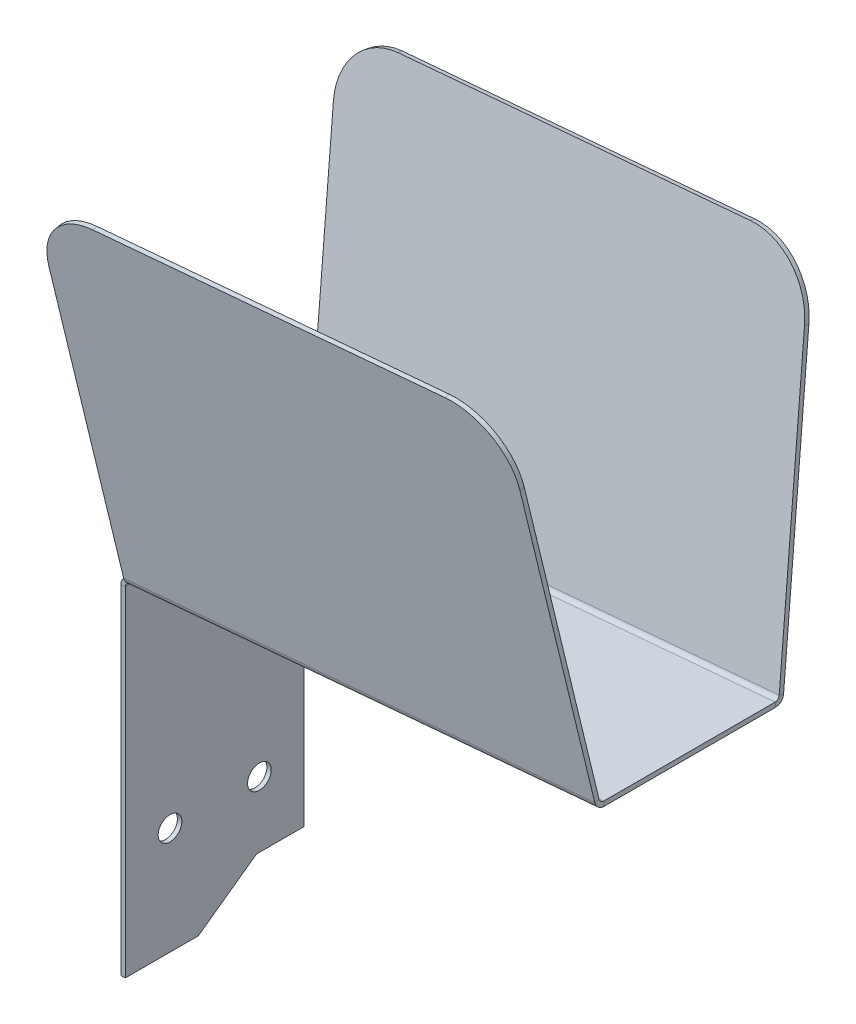
from build123d import *

# Parameters (mm, degrees)
SKETCH1_W                    = 30
SKETCH1_H                    = 57.5
BASE_FLANGE1_DEPTH           = 0.7366
EDGE_FLANGE1_STRIP_CUT_DEPTH = 30
EDGE_FLANGE1_DEPTH           = 30
EDGE_FLANGE2_STRIP_CUT_DEPTH = 79.325030457
EDGE_FLANGE2_DEPTH           = 79.325030457
FILLET1_R                    = 10
CUT_EXTRUDE1_DEPTH           = 126.57552091
CUT_EXTRUDE1_DEPTH_BACK      = 126.57552091
SKETCH14_R                   = 1.984375
CUT_EXTRUDE2_DEPTH           = 126.57552091


# Sheet-metal steps are written as plain solids
with BuildPart() as part:
    # Sketch1 → Base-Flange1 (new body)
    with BuildSketch(Plane(origin=(0, 0, 0), x_dir=(0, 0, -1), z_dir=(1, 0, 0))):
        Rectangle(SKETCH1_W, SKETCH1_H)
    extrude(amount=-BASE_FLANGE1_DEPTH)

    # Edge-Flange1 strip (across the edge) → Edge-Flange1 strip cut (cut)
    with BuildSketch(Plane(origin=(0, 28.75, -15), x_dir=(0.087155742747662, -0.9961946980917452, 0), z_dir=(0, 0, 1))):
        Polygon((-3.794579928, -0.407430966), (0.60820216, -0.792624486), (0.67240108, -0.058827472), (-3.730381008, 0.326366049), align=None)
    extrude(amount=EDGE_FLANGE1_STRIP_CUT_DEPTH, mode=Mode.SUBTRACT)

    # Edge-Flange1 section (across the edge) → Edge-Flange1 (add)
    with BuildSketch(Plane(origin=(0, 28.75, -15), x_dir=(0.087155742747662, -0.9961946980917452, 0), z_dir=(0, 0, 1))):
        with BuildLine():
            Line((-0.7366, 0.674969543), (-0.7366, 80))
            Line((-0.7366, 80), (0, 80))
            Line((0, 80), (0, 0.674969543))
            ThreePointArc((0, 0.674969543), (0.193521514, 0.177329796), (0.67240108, -0.058827472))
            Line((0.67240108, -0.058827472), (0.60820216, -0.792624486))
            ThreePointArc((0.60820216, -0.792624486), (-0.349556973, -0.320309951), (-0.7366, 0.674969543))
        make_face()
    extrude(amount=EDGE_FLANGE1_DEPTH)

    # Edge-Flange2 strip (across the edge) → Edge-Flange2 strip cut (cut)
    with BuildSketch(Plane(origin=(0.60820216, 29.542624486, 15), x_dir=(-0.015134435901339633, 0.17298739392509335, -0.9848077530122075), z_dir=(0.9961946980917453, 0.08715574274766204, 0))):
        Polygon((-3.871674841, -0.065282507), (0.480781505, -0.832737993), (0.608690752, -0.107328603), (-3.743765593, 0.660126883), align=None)
    edge_flange2_strip_cut = extrude(amount=EDGE_FLANGE2_STRIP_CUT_DEPTH, mode=Mode.SUBTRACT)

    # Edge-Flange2 section (across the edge) → Edge-Flange2 (add)
    with BuildSketch(Plane(origin=(0.60820216, 29.542624486, 15), x_dir=(-0.015134435901339633, 0.17298739392509335, -0.9848077530122075), z_dir=(0.9961946980917453, 0.08715574274766204, 0))):
        with BuildLine():
            Line((-0.7366, 0.618080788), (-0.7366, 59))
            Line((-0.7366, 59), (0, 59))
            Line((0, 59), (0, 0.618080788))
            ThreePointArc((0, 0.618080788), (0.172331663, 0.144603435), (0.608690752, -0.107328603))
            Line((0.608690752, -0.107328603), (0.480781505, -0.832737993))
            ThreePointArc((0.480781505, -0.832737993), (-0.391936674, -0.328873918), (-0.7366, 0.618080788))
        make_face()
    edge_flange2 = extrude(amount=EDGE_FLANGE2_DEPTH)

    # Mirror1: Edge-Flange2 strip cut, Edge-Flange2 across plane
    add(edge_flange2_strip_cut.mirror(Plane.XY), mode=Mode.SUBTRACT)
    add(edge_flange2.mirror(Plane.XY))

    # Fillet1
    fillet1_edges = [part.edges().sort_by_distance(p)[0] for p in [
        (74.572883521, 94.275100646, -25.607947178),
        (-4.450291247, 87.361468698, -25.607947178),
        (-4.450291247, 87.361468698, 25.607947178),
        (74.572883521, 94.275100646, 25.607947178),
    ]]
    fillet(fillet1_edges, radius=FILLET1_R)

    # Sketch13 → Cut-Extrude1 (cut, two sides: drawn at the far end of the back side and taken through both)
    with BuildSketch(Plane(origin=(0, 0, 0), x_dir=(0, 0, -1), z_dir=(1, 0, 0)).offset(-CUT_EXTRUDE1_DEPTH_BACK)):
        Polygon((276.166836222, -21.75), (15, -21.75), (7, -21.75), (-2.746794345, -28.75), (-214.875081206, -181.097321129), (-53.649855395, -677.926156777), (437.392062033, -518.578835647), align=None)
    extrude(amount=CUT_EXTRUDE1_DEPTH + CUT_EXTRUDE1_DEPTH_BACK, mode=Mode.SUBTRACT)

    # Sketch14 → Cut-Extrude2 (cut, through all)
    with BuildSketch(Plane(origin=(0, 0, 0), x_dir=(0, 0, -1), z_dir=(1, 0, 0))):
        with Locations((-7.5, -10.75)):
            Circle(SKETCH14_R)
        with Locations((7.5, -10.75)):
            Circle(SKETCH14_R)
    extrude(amount=-CUT_EXTRUDE2_DEPTH, mode=Mode.SUBTRACT)


solid = part.part
